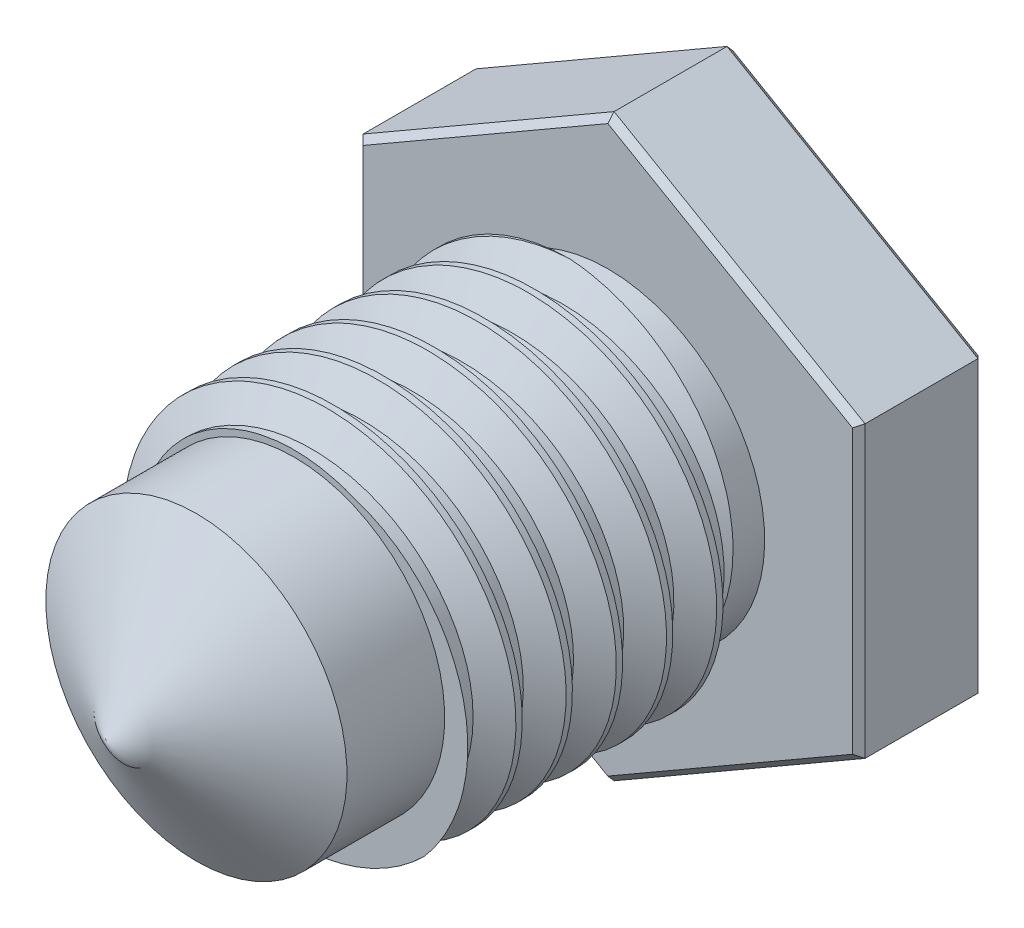
from build123d import *

# Parameters (mm, degrees)
THREAD1_PITCH      = 0.8
SKETCH5_R          = 5.21040517
CUT_EXTRUDE1_DEPTH = 10
CHAMFER1_SIZE      = 0.1
CUT_EXTRUDE2_START = 3
SKETCH7_R          = 2.9330127
SKETCH7_R_2        = 2.4
CUT_EXTRUDE2_DEPTH = 3


with BuildPart() as part:
    # Sketch1 → Revolve1 (revolve)
    with BuildSketch(Plane(origin=(0, 0, 0), x_dir=(0, 0, -1), z_dir=(1, 0, 0))):
        Polygon((-8.237668173, 2.9330127), (-2.6, 2.9330127), (-2.6, 2.5), (-2, 2.5), (-2, 5), (0, 5), (0, 0), (-10, 0), align=None)
    revolve(axis=Axis((0, 0, 0), (0, 0, 1)))

    # Thread1: arcs per turn and ends read off the stored shape
    # Thread1: the profile of Thread Profile1 profile screwed along a right-hand helix through 35 turns, 8 arcs to a turn; built about Z, then put on its axis
    thread1_z = Axis((0, 0, 0), (0, 0, 1))
    thread1_corners = [(2.9333127, 0, -28.000173205), (2.9333127, 0, -27.299826797), (2.5, 0, -27.550000001), (2.5, 0, -27.750000001)]
    with BuildLine(mode=Mode.PRIVATE) as thread1_profile:
        Line(thread1_corners[0], thread1_corners[1])
        Line(thread1_corners[1], thread1_corners[2])
        Line(thread1_corners[2], thread1_corners[3])
        Line(thread1_corners[3], thread1_corners[0])
    thread1_cap = Face(thread1_profile.wire())
    thread1_turn_angles = [0, 22.5, 45, 67.5, 90, 112.5, 135, 157.5, 180, 202.5, 225, 247.5, 270, 292.5, 315, 337.5, 360]
    thread1_turn_weights = [1, 0.9238795325112867, 1, 0.9238795325112867, 1, 0.9238795325112867, 1, 0.9238795325112867, 1, 0.9238795325112867, 1, 0.9238795325112867, 1, 0.9238795325112867, 1, 0.9238795325112867, 1]
    thread1_turn_rails = [Edge.make_bspline([Vector(p[0], p[1], 0).rotate(thread1_z, thread1_turn_angles[k]) / thread1_turn_weights[k] + Vector(0, 0, p[2] + THREAD1_PITCH * thread1_turn_angles[k] / 360) for k in range(17)], [0, 0, 0, 1, 1, 2, 2, 3, 3, 4, 4, 5, 5, 6, 6, 7, 7, 8, 8, 8], 2, thread1_turn_weights) for p in thread1_corners]
    thread1_turn_sides = [Face.make_surface_from_curves(thread1_turn_rails[p[0]], thread1_turn_rails[p[1]]) for p in [(0, 1), (1, 2), (2, 3), (3, 0)]]
    thread1 = Plane(origin=(0, 0, 2.7), x_dir=(-1, 0, 0), z_dir=(0, 0, -1)) * Solid(Shell([*[p.moved(Location((0, 0, THREAD1_PITCH * i))) for i in range(35) for p in thread1_turn_sides], thread1_cap, thread1_cap.rotate(thread1_z, 12600).moved(Location((0, 0, THREAD1_PITCH * 12600 / 360)))]))
    add(thread1, mode=Mode.SUBTRACT)

    # Sketch5 → Cut-Extrude1 (cut)
    with BuildSketch(Plane(origin=(0, 0, 0), x_dir=(-1, 0, 0), z_dir=(0, 0, -1))):
        Circle(SKETCH5_R)
        Polygon((0, 4.618802154), (-4, 2.309401077), (-4, -2.309401077), (0, -4.618802154), (4, -2.309401077), (4, 2.309401077), align=None, mode=Mode.SUBTRACT)
    extrude(amount=-CUT_EXTRUDE1_DEPTH, mode=Mode.SUBTRACT)

    # Chamfer1
    chamfer1_edges = [part.edges().sort_by_distance(p)[0] for p in [
        (-2, 3.464101615, 2),
        (-2, 3.464101615, 0),
        (-4, 0, 2),
        (-4, 0, 0),
        (-2, -3.464101615, 2),
        (-2, -3.464101615, 0),
        (2, -3.464101615, 2),
        (2, -3.464101615, 0),
        (4, 0, 2),
        (4, 0, 0),
        (2, 3.464101615, 2),
        (2, 3.464101615, 0),
    ]]
    chamfer(chamfer1_edges, length=CHAMFER1_SIZE)

    # Sketch7 → Cut-Extrude2 (cut)
    with BuildSketch(Plane(origin=(0, 0, 10), x_dir=(-1, 0, 0), z_dir=(0, 0, -1)).offset(CUT_EXTRUDE2_START)):
        Circle(SKETCH7_R)
        with Locations(Location((0, 0, 0), (0, 0, 90))):
            Circle(SKETCH7_R_2, mode=Mode.SUBTRACT)
    extrude(amount=-CUT_EXTRUDE2_DEPTH, mode=Mode.SUBTRACT)


solid = part.part
